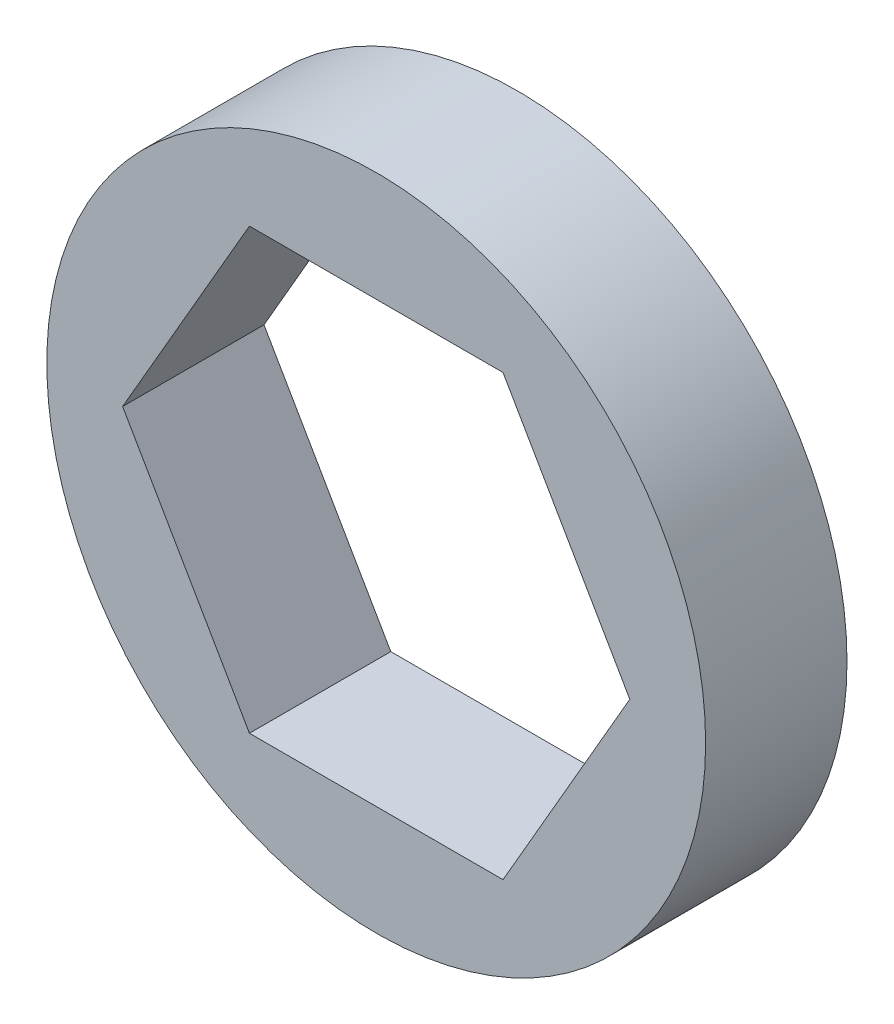
from build123d import *

# Parameters (mm, degrees)
SKETCH1_R           = 9.525
BOSS_EXTRUDE1_DEPTH = 4.087622


with BuildPart() as part:
    # Sketch1 → Boss-Extrude1 (new body)
    with BuildSketch(Plane.XY):
        Circle(SKETCH1_R)
        Polygon((3.666174209, 6.35), (-3.666174209, 6.35), (-7.332348419, 0), (-3.666174209, -6.35), (3.666174209, -6.35), (7.332348419, 0), align=None, mode=Mode.SUBTRACT)
    extrude(amount=BOSS_EXTRUDE1_DEPTH)


solid = part.part
